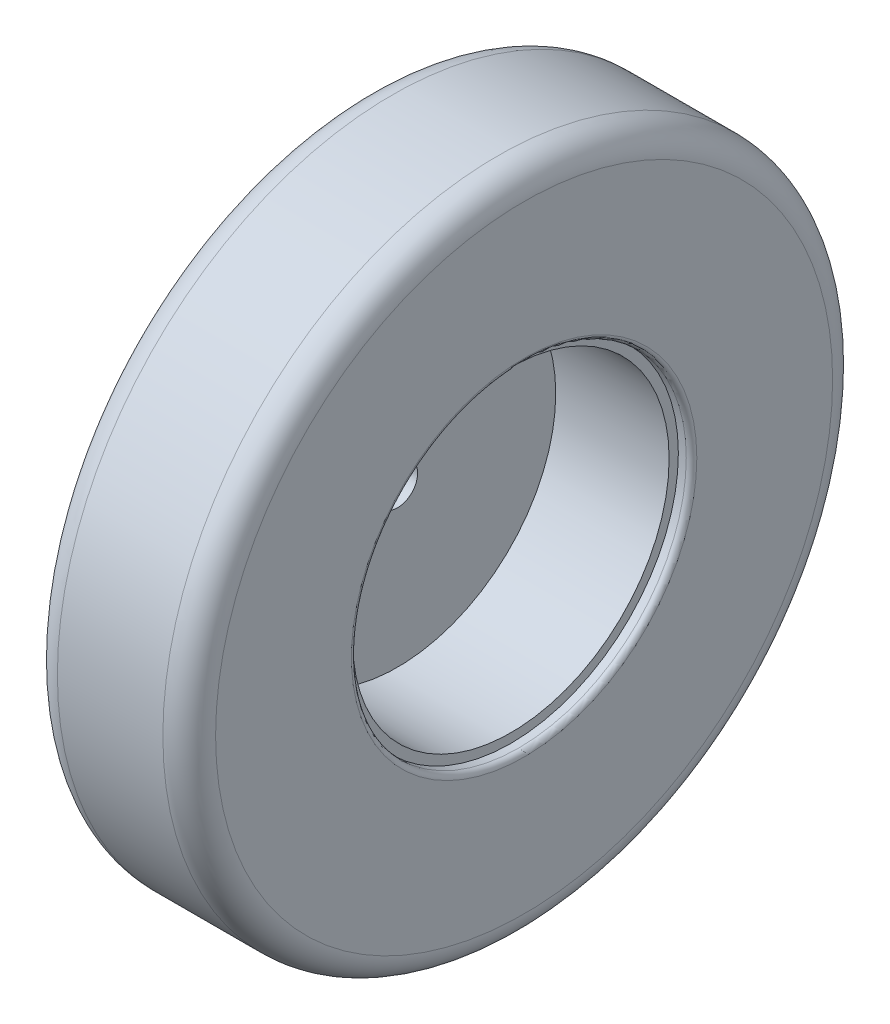
from build123d import *

# Parameters (mm, degrees)
HUB_START      = 5
SKETCH1_R      = 63.5
SKETCH1_R_2    = 7.625
HUB_FACE_DEPTH = 7
SKETCH2_R      = 63.5
SKETCH2_R_2    = 60
HUB_DEPTH      = 50
SKETCH3_R      = 127
SKETCH3_R_2    = 63.5
RUBBER_DEPTH   = 60
FILLET1_R      = 10
FILLET2_R      = 2


with BuildPart() as part:
    # Sketch1 → Hub Face (new body)
    with BuildSketch(Plane(origin=(0, 0, 0), x_dir=(0, 0, -1), z_dir=(1, 0, 0)).offset(HUB_START)):
        Circle(SKETCH1_R)
        Circle(SKETCH1_R_2, mode=Mode.SUBTRACT)
    extrude(amount=HUB_FACE_DEPTH)

    # Sketch2 → Hub (add)
    with BuildSketch(Plane(origin=(0, 0, 0), x_dir=(0, 0, -1), z_dir=(1, 0, 0)).offset(HUB_START)):
        Circle(SKETCH2_R)
        Circle(SKETCH2_R_2, mode=Mode.SUBTRACT)
    extrude(amount=HUB_DEPTH)

    # Sketch3 → Rubber (add)
    with BuildSketch(Plane(origin=(0, 0, 0), x_dir=(0, 0, -1), z_dir=(1, 0, 0))):
        Circle(SKETCH3_R)
        Circle(SKETCH3_R_2, mode=Mode.SUBTRACT)
    extrude(amount=RUBBER_DEPTH)

    # Fillet1
    fillet1_edges = [part.edges().sort_by_distance(p)[0] for p in [
        (0, 0, 127),
        (60, 0, 127),
    ]]
    fillet(fillet1_edges, radius=FILLET1_R)

    # Fillet2
    fillet2_edges = [part.edges().sort_by_distance(p)[0] for p in [
        (60, 0, 63.5),
        (0, 0, 63.5),
    ]]
    fillet(fillet2_edges, radius=FILLET2_R)


solid = part.part
